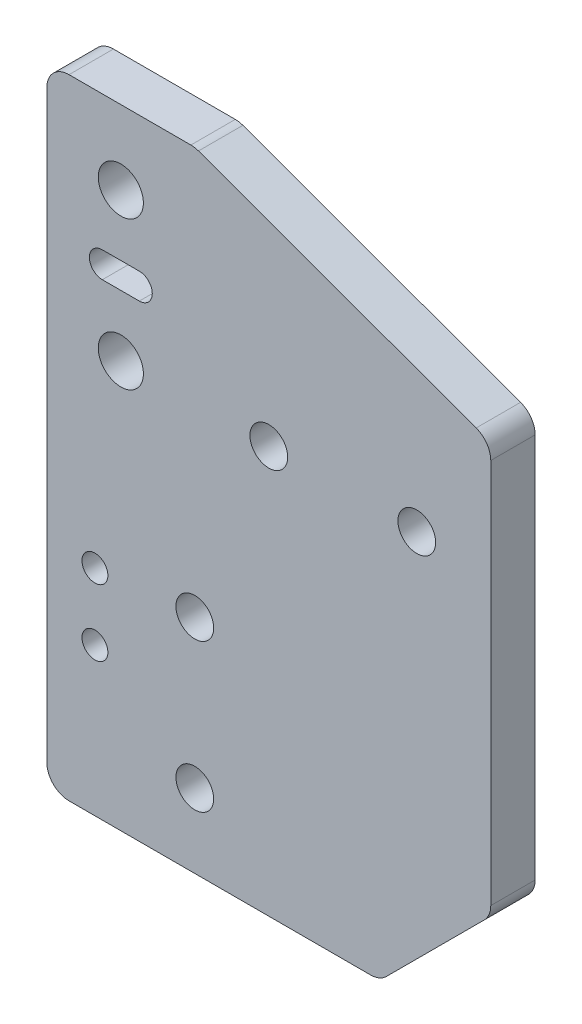
from build123d import *

# Parameters (mm, degrees)
MODEL_R                  = 3.05
MODEL_R_2                = 2.55
BODY_DEPTH               = 6
SKETCH3_R                = 1.75
CABLEMOUNT_DEPTH         = 105.216121594
F_5_1_5_1_FOOTINGMOUNT_D = 5.1


with BuildPart() as part:
    # Model → Body (new body)
    with BuildSketch(Plane.XY):
        with BuildLine():
            Line((59.121320344, 14.121320344), (45.878679656, 0.878679656))
            ThreePointArc((45.878679656, 0.878679656), (44.90540961, 0.228361402), (43.757359313, 0))
            Line((43.757359313, 0), (3, 0))
            ThreePointArc((3, 0), (0.878679656, 0.878679656), (0, 3))
            Line((0, 3), (0, 82))
            ThreePointArc((0, 82), (0.878679656, 84.121320344), (3, 85))
            Line((3, 85), (19.471019058, 85))
            ThreePointArc((19.471019058, 85), (19.991963591, 84.954423259), (20.497079488, 84.819077862))
            Line((20.497079488, 84.819077862), (58.02606043, 71.159645877))
            ThreePointArc((58.02606043, 71.159645877), (59.457456133, 70.061297324), (60, 68.340568015))
            Line((60, 68.340568015), (60, 16.242640687))
            ThreePointArc((60, 16.242640687), (59.771638598, 15.09459039), (59.121320344, 14.121320344))
        make_face()
        with Locations((10, 75)):
            Circle(MODEL_R, mode=Mode.SUBTRACT)
        with Locations((10, 55)):
            Circle(MODEL_R, mode=Mode.SUBTRACT)
        with Locations((30, 55)):
            Circle(MODEL_R_2, mode=Mode.SUBTRACT)
        with Locations((50, 55)):
            Circle(MODEL_R_2, mode=Mode.SUBTRACT)
        with BuildLine():
            Line((12.5, 63.25), (7.5, 63.25))
            ThreePointArc((7.5, 63.25), (5.75, 65), (7.5, 66.75))
            Line((7.5, 66.75), (12.5, 66.75))
            ThreePointArc((12.5, 66.75), (14.25, 65), (12.5, 63.25))
        make_face(mode=Mode.SUBTRACT)
    extrude(amount=BODY_DEPTH)

    # Sketch3 → CableMount (cut, through all)
    with BuildSketch(Plane.XY.offset(6)):
        with Locations((6.5, 29)):
            Circle(SKETCH3_R)
        with Locations((6.5, 20)):
            Circle(SKETCH3_R)
    extrude(amount=-CABLEMOUNT_DEPTH, mode=Mode.SUBTRACT)

    # Ø5.1 (5.1) FootingMount (through all)
    with Locations(Plane.XY.offset(6)):
        with Locations((20, 10), (20, 30)):
            Hole(F_5_1_5_1_FOOTINGMOUNT_D / 2)


solid = part.part
